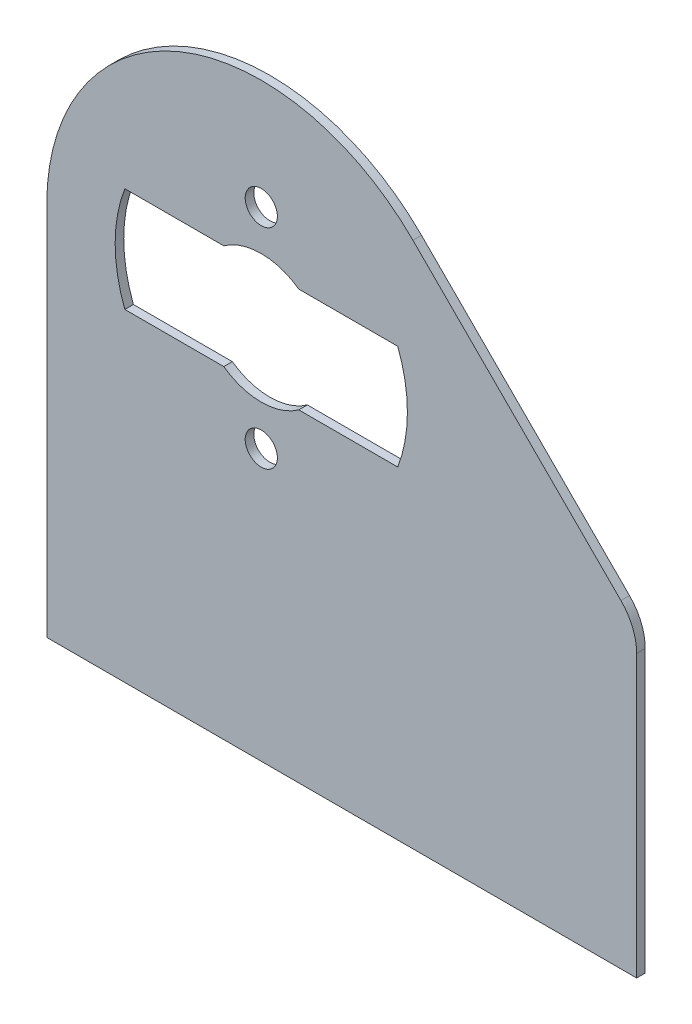
from build123d import *

# Parameters (mm, degrees)
SKETCH_2_R      = 3
EXTRUDE_2_DEPTH = 1.6
FILLET_1_R      = 10


with BuildPart() as part:
    # ｽｹｯﾁ2 → ﾎﾞｽ - 押し出し2 (new body)
    with BuildSketch(Plane.XY):
        with BuildLine():
            ThreePointArc((28.284271247, 28.284271247), (-15.307337295, 36.9551813), (-40, 0))
            Line((-40, 0), (-40, -70))
            Line((-40, -70), (70, -70))
            Line((70, -70), (70, -13.431457505))
            Line((70, -13.431457505), (28.284271247, 28.284271247))
        make_face()
        with Locations((0, -19.5)):
            Circle(SKETCH_2_R, mode=Mode.SUBTRACT)
        with BuildLine():
            Line((-6.99553429, -9.75), (-12.241706376, -9.75))
            Line((-12.241706376, -9.75), (-25.4460213, -9.75))
            ThreePointArc((-25.4460213, -9.75), (-27.25, 0), (-25.4460213, 9.75))
            Line((-25.4460213, 9.75), (-12.241706376, 9.75))
            Line((-12.241706376, 9.75), (-6.99553429, 9.75))
            ThreePointArc((-6.99553429, 9.75), (0, 12), (6.99553429, 9.75))
            Line((6.99553429, 9.75), (25.4460213, 9.75))
            ThreePointArc((25.4460213, 9.75), (27.25, 0), (25.4460213, -9.75))
            Line((25.4460213, -9.75), (9.75, -9.75))
            Line((9.75, -9.75), (6.99553429, -9.75))
            ThreePointArc((6.99553429, -9.75), (0, -12), (-6.99553429, -9.75))
        make_face(mode=Mode.SUBTRACT)
        with Locations((0, 19.5)):
            Circle(SKETCH_2_R, mode=Mode.SUBTRACT)
    extrude(amount=EXTRUDE_2_DEPTH)

    # 可変ﾌｨﾚｯﾄ1
    fillet_1_edges = [part.edges().sort_by_distance(p)[0] for p in [
        (70, -13.431457505, 0.8),
    ]]
    fillet(fillet_1_edges, radius=FILLET_1_R)


solid = part.part
